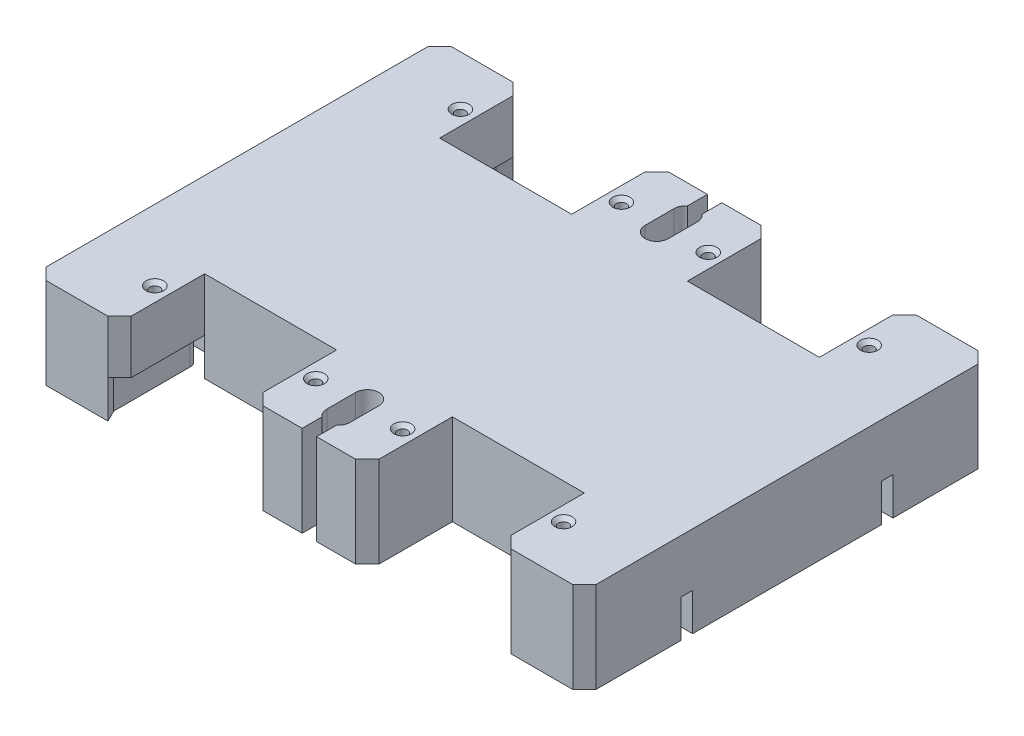
from build123d import *
from build123d.topology import SkipClean

# Parameters (mm, degrees)
SKETCH1_W            = 95
SKETCH1_H            = 70
BOSS_EXTRUDE1_DEPTH  = 7.85
CUT_EXTRUDE1_DEPTH   = 62.055220907
CHAMFER1_SIZE        = 2
CUT_EXTRUDE2_DEPTH   = 6.5
CUT_EXTRUDE3_DEPTH   = 60.715073474
MIRROR3_COPY_1_DEPTH = 6.5
SKETCH7_W            = 60
SKETCH7_H            = 22
CUT_EXTRUDE4_DEPTH   = 9.5


# Read off the part's stored shape, not the designer's step: CSK for M2 Flat Head Machine Screw1
with BuildPart() as part:
    # Sketch1 → Boss-Extrude1 (new, symmetric)
    with BuildSketch(Plane(origin=(0, 0, 0), x_dir=(1, 0, 0), z_dir=(0, 1, 0))):
        Rectangle(SKETCH1_W, SKETCH1_H)
    extrude(amount=BOSS_EXTRUDE1_DEPTH, both=True)

    # Sketch2 → Cut-Extrude1 (cut, through all)
    with BuildSketch(Plane(origin=(0, 7.85, 0), x_dir=(1, 0, 0), z_dir=(0, 1, 0))):
        Polygon((-32.8, -32.5), (-32.8, -20.3), (-10, -20.3), (-10, -32.5), (-10, -35), (-32.8, -35), align=None)
        Polygon((10, -32.5), (10, -20.3), (32.8, -20.3), (32.8, -32.5), (32.8, -35), (10, -35), align=None)
    cut_extrude1 = extrude(amount=-CUT_EXTRUDE1_DEPTH, mode=Mode.SUBTRACT)

    # CSK for M2 Flat Head Machine Screw1 outl → CSK for M2 Flat Head Machine Screw1 (revolve, cut)
    with BuildSketch(Plane(origin=(35.3, 0, 26.4), x_dir=(1, 0, 0), z_dir=(0, 0, 1))):
        Polygon((0, 7.85), (0, -0.672748739), (0.87, -0.15), (0.87, 7.22), (1.5, 7.85), align=None)
    csk_for_m2_flat_head_machine_screw1 = revolve(axis=Axis((35.3, 0, 26.4), (0, 1, 0)), mode=Mode.SUBTRACT)

    # CSK for M2 Flat Head Machine Screw1 2 ou → CSK for M2 Flat Head Machine Screw1 2 (revolve, cut)
    with BuildSketch(Plane(origin=(7.5, 0, 26.4), x_dir=(1, 0, 0), z_dir=(0, 0, 1))):
        Polygon((0, 7.85), (0, -0.672748739), (0.87, -0.15), (0.87, 7.22), (1.5, 7.85), align=None)
    csk_for_m2_flat_head_machine_screw1_2 = revolve(axis=Axis((7.5, 0, 26.4), (0, 1, 0)), mode=Mode.SUBTRACT)

    # CSK for M2 Flat Head Machine Screw1 3 ou → CSK for M2 Flat Head Machine Screw1 3 (revolve, cut)
    with BuildSketch(Plane(origin=(-7.5, 0, 26.4), x_dir=(1, 0, 0), z_dir=(0, 0, 1))):
        Polygon((0, 7.85), (0, -0.672748739), (0.87, -0.15), (0.87, 7.22), (1.5, 7.85), align=None)
    csk_for_m2_flat_head_machine_screw1_3 = revolve(axis=Axis((-7.5, 0, 26.4), (0, 1, 0)), mode=Mode.SUBTRACT)

    # CSK for M2 Flat Head Machine Screw1 4 ou → CSK for M2 Flat Head Machine Screw1 4 (revolve, cut)
    with BuildSketch(Plane(origin=(-35.3, 0, 26.4), x_dir=(1, 0, 0), z_dir=(0, 0, 1))):
        Polygon((0, 7.85), (0, -0.672748739), (0.87, -0.15), (0.87, 7.22), (1.5, 7.85), align=None)
    csk_for_m2_flat_head_machine_screw1_4 = revolve(axis=Axis((-35.3, 0, 26.4), (0, 1, 0)), mode=Mode.SUBTRACT)

    # Mirror1: Cut-Extrude1, CSK for M2 Flat Head Machine Screw1, CSK for M2 Flat Head Machine Screw1 2, CSK for M2 Flat Head Machine Screw1 3, CSK for M2 Flat Head Machine Screw1 4 across plane
    add(cut_extrude1.mirror(Plane.XY), mode=Mode.SUBTRACT)
    add(csk_for_m2_flat_head_machine_screw1.mirror(Plane.XY), mode=Mode.SUBTRACT)
    add(csk_for_m2_flat_head_machine_screw1_2.mirror(Plane.XY), mode=Mode.SUBTRACT)
    add(csk_for_m2_flat_head_machine_screw1_3.mirror(Plane.XY), mode=Mode.SUBTRACT)
    add(csk_for_m2_flat_head_machine_screw1_4.mirror(Plane.XY), mode=Mode.SUBTRACT)

    # Chamfer1
    chamfer1_edges = [part.edges().sort_by_distance(p)[0] for p in [
        (-32.8, 0, 35),
        (-10, 0, 35),
        (10, 0, 35),
        (32.8, 0, 35),
        (47.5, 0, 35),
        (-47.5, 0, 35),
        (-47.5, 0, -35),
        (47.5, 0, -35),
        (-32.8, 0, -35),
        (-10, 0, -35),
        (10, 0, -35),
        (32.8, 0, -35),
    ]]
    chamfer(chamfer1_edges, length=CHAMFER1_SIZE)

    # Sketch5 → Cut-Extrude2 (cut)
    with BuildSketch(Plane.XZ.offset(7.85)):
        with BuildLine():
            Line((47.5, 16.3), (-2, 16.3))
            Line((-2, 16.3), (-2, 30))
            ThreePointArc((-2, 30), (0, 32), (2, 30))
            Line((2, 30), (2, 21.3))
            ThreePointArc((2, 21.3), (2.878679656, 19.178679656), (5, 18.3))
            Line((5, 18.3), (30.8, 18.3))
            ThreePointArc((30.8, 18.3), (32.214213562, 18.885786438), (32.8, 20.3))
            Line((32.8, 20.3), (32.8, 33))
            Line((32.8, 33), (34.8, 35))
            Line((34.8, 35), (35.8, 33))
            Line((35.8, 33), (35.8, 19.8))
            ThreePointArc((35.8, 19.8), (36.239339828, 18.739339828), (37.3, 18.3))
            Line((37.3, 18.3), (47.5, 18.3))
            Line((47.5, 18.3), (47.5, 16.3))
        make_face()
    cut_extrude2 = extrude(amount=-CUT_EXTRUDE2_DEPTH, mode=Mode.SUBTRACT)

    # Sketch6 → Cut-Extrude3 (cut, symmetric)
    with SkipClean():  # the faces are left unmerged after this step: merging them gives an invalid solid
        with BuildSketch(Plane.XZ.offset(1.35)):
            with BuildLine():
                Line((2, 25), (2, 30))
                ThreePointArc((2, 30), (1.802775638, 30.866025404), (1.25, 31.5612495))
                Line((1.25, 31.5612495), (1.25, 35))
                Line((1.25, 35), (-1.25, 35))
                Line((-1.25, 35), (-1.25, 31.5612495))
                ThreePointArc((-1.25, 31.5612495), (-1.802775638, 30.866025404), (-2, 30))
                Line((-2, 30), (-2, 25))
                ThreePointArc((-2, 25), (0, 23), (2, 25))
            make_face()
        cut_extrude3 = extrude(amount=CUT_EXTRUDE3_DEPTH, both=True, mode=Mode.SUBTRACT)
    add(part.part.scale(1), mode=Mode.REPLACE)  # the faces are merged on a copy

    # Mirror2: Cut-Extrude2 across plane
    add(cut_extrude2.mirror(Plane(origin=(0, 0, 0), x_dir=(0, 0, 1), z_dir=(1, 0, 0))), mode=Mode.SUBTRACT)

    # Mirror3: Cut-Extrude2, Cut-Extrude3 across plane
    add(cut_extrude2.mirror(Plane.XY), mode=Mode.SUBTRACT)
    add(cut_extrude3.mirror(Plane.XY), mode=Mode.SUBTRACT)

    # Mirror3 copy 1 sketch → Mirror3 copy 1 (cut)
    with BuildSketch(Plane(origin=(0, -7.85, 0), x_dir=(-1, 0, 0), z_dir=(0, -1, 0))):
        with BuildLine():
            Line((47.5, 16.3), (-2, 16.3))
            Line((-2, 16.3), (-2, 30))
            ThreePointArc((-2, 30), (0, 32), (2, 30))
            Line((2, 30), (2, 21.3))
            ThreePointArc((2, 21.3), (2.878679656, 19.178679656), (5, 18.3))
            Line((5, 18.3), (30.8, 18.3))
            ThreePointArc((30.8, 18.3), (32.214213562, 18.885786438), (32.8, 20.3))
            Line((32.8, 20.3), (32.8, 33))
            Line((32.8, 33), (34.8, 35))
            Line((34.8, 35), (35.8, 33))
            Line((35.8, 33), (35.8, 19.8))
            ThreePointArc((35.8, 19.8), (36.239339828, 18.739339828), (37.3, 18.3))
            Line((37.3, 18.3), (47.5, 18.3))
            Line((47.5, 18.3), (47.5, 16.3))
        make_face()
    extrude(amount=-MIRROR3_COPY_1_DEPTH, mode=Mode.SUBTRACT)

    # Sketch7 → Cut-Extrude4 (cut)
    with BuildSketch(Plane.XZ.offset(7.85)):
        Rectangle(SKETCH7_W, SKETCH7_H)
    extrude(amount=-CUT_EXTRUDE4_DEPTH, mode=Mode.SUBTRACT)


solid = part.part
